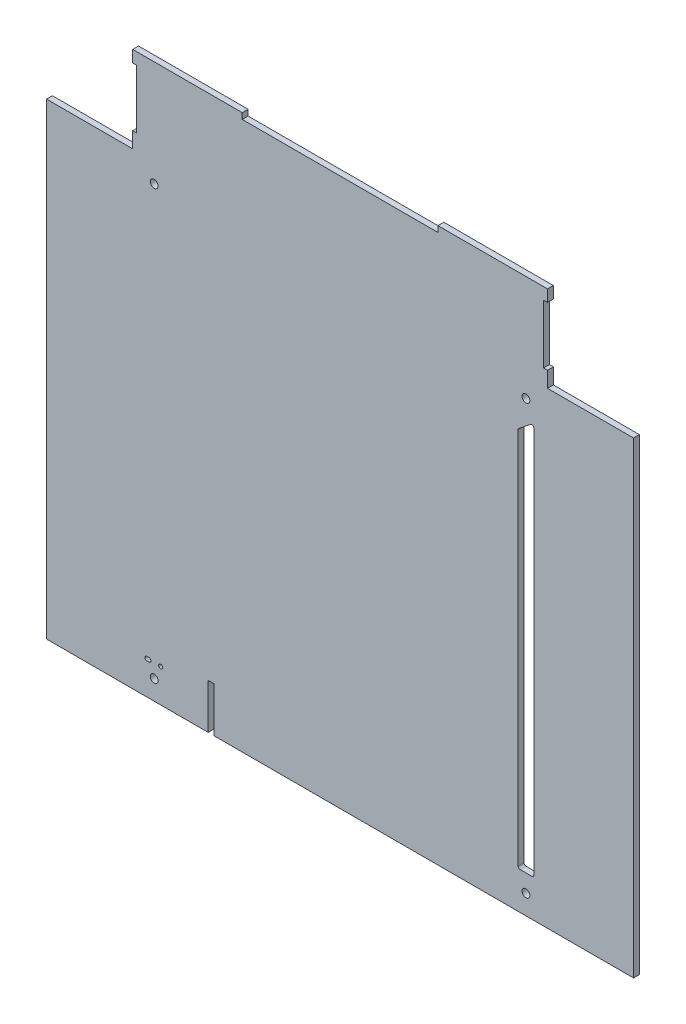
from build123d import *

# Parameters (mm, degrees)
SKETCH1_R                = 2
BOSS_EXTRUDE1_DEPTH      = 3
SCHIZZO1_W               = 2
SCHIZZO1_H               = 30
SCHIZZO1_W_2             = 100
SCHIZZO1_H_2             = 3
TAGLIO_ESTRUSIONE1_DEPTH = 10
RACCORDO1_R              = 1
SCHIZZO2_R               = 1
TAGLIO_ESTRUSIONE2_DEPTH = 10


with BuildPart() as part:
    # Sketch1 → Boss-Extrude1 (new body)
    with BuildSketch(Plane.XY):
        Polygon((-64.411122483, -119.5), (150, -119.5), (150, 119.5), (106, 119.5), (106, 163.5), (-106, 163.5), (-106, 119.5), (-150, 119.5), (-150, -119.5), (-67.411122483, -119.5), (-67.411122483, -96.5), (-64.411122483, -96.5), align=None)
        with Locations((-95, -109.5)):
            Circle(SKETCH1_R, mode=Mode.SUBTRACT)
        with Locations((95, -109.5)):
            Circle(SKETCH1_R, mode=Mode.SUBTRACT)
        Polygon((91, 94.126666667), (99, 100.5), (99, -100.5), (91, -100.5), align=None, mode=Mode.SUBTRACT)
        with Locations((-95, 109.5)):
            Circle(SKETCH1_R, mode=Mode.SUBTRACT)
        with Locations((95, 109.5)):
            Circle(SKETCH1_R, mode=Mode.SUBTRACT)
    extrude(amount=BOSS_EXTRUDE1_DEPTH)

    # Schizzo1 → Taglio-Estrusione1 (cut)
    with BuildSketch(Plane(origin=(0, 0, 0), x_dir=(-1, 0, 0), z_dir=(0, 0, -1))):
        with Locations((-105, 142.5)):
            Rectangle(SCHIZZO1_W, SCHIZZO1_H)
        with Locations((0, 162)):
            Rectangle(SCHIZZO1_W_2, SCHIZZO1_H_2)
        with Locations((105, 142.5)):
            Rectangle(SCHIZZO1_W, SCHIZZO1_H)
    extrude(amount=-TAGLIO_ESTRUSIONE1_DEPTH, mode=Mode.SUBTRACT)

    # Raccordo1
    raccordo1_edges = [part.edges().sort_by_distance(p)[0] for p in [
        (91, -100.5, 1.5),
        (99, -100.5, 1.5),
        (91, 94.126666667, 1.5),
        (99, 100.5, 1.5),
    ]]
    fillet(raccordo1_edges, radius=RACCORDO1_R)

    # Schizzo2 → Taglio-Estrusione2 (cut)
    with BuildSketch(Plane.XY.offset(3)):
        with BuildLine():
            Line((-97.677859293, -101.476648927), (-98.677859293, -101.476648927))
            ThreePointArc((-98.677859293, -101.476648927), (-99.701210366, -102.5), (-98.677859293, -103.523351073))
            Line((-98.677859293, -103.523351073), (-97.677859293, -103.523351073))
            ThreePointArc((-97.677859293, -103.523351073), (-96.65450822, -102.5), (-97.677859293, -101.476648927))
        make_face()
        with Locations((-91.677859293, -102.5)):
            Circle(SCHIZZO2_R)
    extrude(amount=-TAGLIO_ESTRUSIONE2_DEPTH, mode=Mode.SUBTRACT)


solid = part.part
